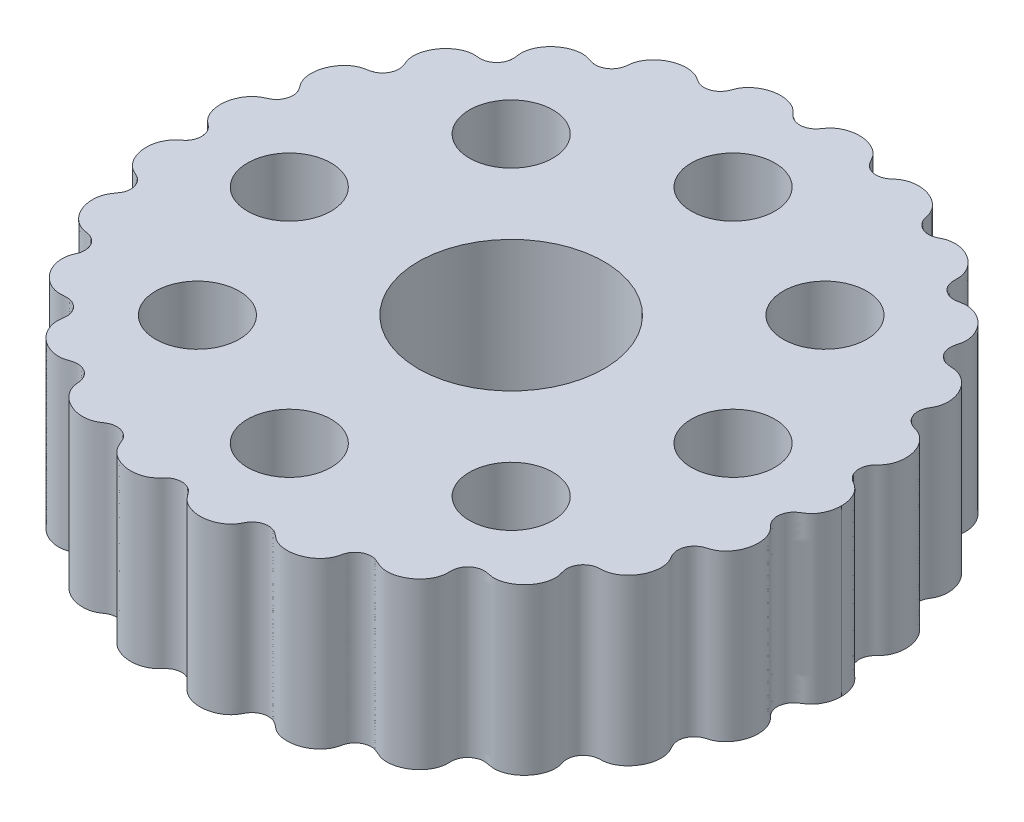
from build123d import *

# Parameters (mm, degrees)
SKETCH2_R           = 9
SKETCH2_R_2         = 4.05
BOSS_EXTRUDE1_DEPTH = 16


with BuildPart() as part:
    # Sketch2 → Boss-Extrude1 (new body)
    with BuildSketch(Plane(origin=(0, 0, 0), x_dir=(1, 0, 0), z_dir=(0, 1, 0))):
        with BuildLine():
            add(Edge.make_bspline(
                [(32, 0), (32, 0.104552359), (31.995829451, 0.244657698), (31.96343554, 0.497350887), (31.943165067, 0.61993286), (31.901921603, 0.80568742), (31.852763502, 0.982893961), (31.760589105, 1.245804685), (31.627237124, 1.52279712), (31.469006513, 1.77987865), (31.318033979, 1.972256306), (31.188685154, 2.110042639), (31.08776003, 2.205033558), (30.999896393, 2.277793707), (30.927586616, 2.332015187), (30.871350262, 2.371443406), (30.808959786, 2.412466941), (30.751215591, 2.448323808), (30.692536257, 2.483902195), (30.642070523, 2.514002995), (30.55901953, 2.565809095), (30.469377479, 2.623038148), (30.321527704, 2.737539295), (30.176012212, 2.871552443), (29.903186489, 3.199909992), (29.700236636, 3.880910214), (29.818309853, 4.4864096), (29.981846057, 4.79028647), (30.090970352, 4.944247476), (30.17460262, 5.045909438), (30.244053458, 5.122786372), (30.311532105, 5.192651081), (30.35745816, 5.238896611), (30.401172942, 5.283216119), (30.443609982, 5.32775139), (30.493548536, 5.383032964), (30.539132759, 5.4366663), (30.596386498, 5.508393759), (30.662356638, 5.599742771), (30.736452975, 5.717426066), (30.804511185, 5.841985834), (30.886870921, 6.016733349), (30.973207508, 6.250013511), (31.047548585, 6.547210121), (31.091258139, 6.856419861), (31.107870152, 7.278384281), (31.049891116, 7.811823414), (30.858103265, 8.42874362), (30.604284315, 8.89743226), (30.353358646, 9.229411908), (30.144291631, 9.452912412), (29.955708118, 9.614738773), (29.79910746, 9.727251873), (29.679319525, 9.802888314), (29.557565984, 9.869588689), (29.455588888, 9.917292552), (29.370396403, 9.95225453), (29.304219555, 9.977077554), (29.232725716, 10.001492535), (29.174448038, 10.019646819), (29.108818525, 10.039159146), (29.039840554, 10.059223915), (28.931074643, 10.095014686), (28.833939509, 10.127640531), (28.652968123, 10.2098928), (28.42260129, 10.336760516), (28.019143925, 10.711051717), (27.761965655, 11.354332939), (27.789507147, 11.891036105), (27.87221039, 12.163811806), (27.935251939, 12.315347057), (27.985501378, 12.417480742), (28.024991397, 12.491719407), (28.06947836, 12.570632793), (28.102908707, 12.628110139), (28.137872269, 12.688330119), (28.167209651, 12.740503157), (28.199361547, 12.801997668), (28.229499494, 12.864308614), (28.266797357, 12.948101554), (28.308366222, 13.054879476), (28.350623015, 13.187611316), (28.396712271, 13.370662906), (28.435043025, 13.611892848), (28.448908857, 13.915240837), (28.430019045, 14.223703272), (28.361500214, 14.638188146), (28.196911243, 15.147181142), (27.883300662, 15.71249513), (27.53860302, 16.121393259), (27.223639196, 16.398310017), (26.971817218, 16.577434962), (26.708067889, 16.725352804), (26.483376119, 16.819944918), (26.303628631, 16.877405045), (26.169148263, 16.911363393), (26.058524801, 16.931910053), (25.967118106, 16.944379376), (25.896640852, 16.951812934), (25.820780347, 16.957565886), (25.759838564, 16.960490442), (25.687870542, 16.963224576), (25.611963098, 16.965502659), (25.489490968, 16.975098019), (25.383984869, 16.981519114), (25.145326776, 17.031127475), (24.83545184, 17.124405377), (24.306622424, 17.505424554), (24.006772436, 18.090477523), (23.958888189, 18.540418781), (23.986174408, 18.852722806), (24.01934153, 18.987870495), (24.041791154, 19.084745192), (24.064644506, 19.167384365), (24.081952801, 19.228944541), (24.100111084, 19.293474135), (24.115170355, 19.350473226), (24.130897605, 19.418203947), (24.144392609, 19.485961231), (24.159450449, 19.576415233), (24.172868415, 19.690224451), (24.180449364, 19.829400723), (24.179433235, 19.97115919), (24.16652918, 20.163619715), (24.12851506, 20.410452195), (24.049229739, 20.706447103), (23.900019674, 21.095357267), (23.636415258, 21.559161529), (23.214511253, 22.048446484), (22.792528514, 22.37994239), (22.426260545, 22.588784498), (22.141240504, 22.714946241), (21.849177494, 22.809134729), (21.607677317, 22.858570104), (21.416097433, 22.880750301), (21.273531458, 22.888737815), (21.13391659, 22.887914443), (21.024423736, 22.880226916), (20.935791711, 22.86954177), (20.864722963, 22.85871337), (20.786771795, 22.844665842), (20.711729149, 22.829472252), (20.648015818, 22.81589924), (20.584655505, 22.802234304), (20.485953998, 22.782237116), (20.367126506, 22.765318385), (20.239852309, 22.751878016), (20.031705229, 22.752803226), (19.649405208, 22.788057784), (18.99695201, 23.155474328), (18.683045878, 23.649276859), (18.576999256, 24.003400852), (18.542947223, 24.264963729), (18.542038834, 24.379953401), (18.540471611, 24.480242727), (18.542125383, 24.560748637), (18.543546065, 24.622458485), (18.544952615, 24.687004459), (18.545224364, 24.745260227), (18.543444351, 24.814872528), (18.539495143, 24.883749829), (18.531356095, 24.975074493), (18.515760874, 25.088604194), (18.488125739, 25.225325383), (18.439348183, 25.408045878), (18.35551971, 25.637927338), (18.220248764, 25.91002869), (17.998328956, 26.25781591), (17.647679344, 26.657159235), (17.135653065, 27.049771615), (16.557822491, 27.336905777), (16.046936249, 27.475590363), (15.636646996, 27.521420752), (15.335050355, 27.522743408), (15.094105128, 27.496277469), (14.907486188, 27.458883387), (14.772655381, 27.42305117), (14.668854131, 27.388188028), (14.585603761, 27.355523076), (14.519125435, 27.327024127), (14.446456923, 27.293556372), (14.376454811, 27.259514284), (14.317280658, 27.230103106), (14.254656827, 27.198715646), (14.154486211, 27.151231002), (14.034088625, 27.102668267), (13.892770508, 27.054813025), (13.686947078, 27.006403392), (13.417853878, 26.989316109), (13.124928138, 27.015651051), (12.788162718, 27.123824563), (12.415040219, 27.347559755), (12.132565961, 27.669159911), (11.994348732, 27.93802665), (11.91672635, 28.145426445), (11.892224449, 28.240319141), (11.866457855, 28.336544686), (11.843448669, 28.435340061), (11.824275636, 28.518203577), (11.807258136, 28.585187035), (11.788032612, 28.652210348), (11.766942716, 28.717792178), (11.73613561, 28.804129705), (11.69251815, 28.910120225), (11.631400501, 29.035602491), (11.561487632, 29.159226768), (11.456493062, 29.321497294), (11.303240918, 29.518991484), (11.090015553, 29.739484209), (10.850490687, 29.940278513), (10.500724897, 30.177969535), (10.017333975, 30.411108368), (9.392606591, 30.574859819), (8.860920839, 30.607546875), (8.447263288, 30.570142354), (8.146290077, 30.510728768), (7.911901543, 30.436850188), (7.733785646, 30.363178187), (7.605241298, 30.300850441), (7.48371312, 30.232318108), (7.392503104, 30.172830587), (7.320512528, 30.120545554), (7.26305649, 30.076024441), (7.200067504, 30.024540041), (7.138660524, 29.972287993), (7.08672707, 29.927530674), (7.031720851, 29.879828085), (6.940907967, 29.805117669), (6.820127718, 29.718028271), (6.663332447, 29.62335176), (6.44551997, 29.52078195), (6.114639508, 29.443538741), (5.770234773, 29.433760049), (5.429192518, 29.506762993), (5.075008587, 29.663900411), (4.78655183, 29.901702256), (4.632643226, 30.093772504), (4.529362242, 30.248291257), (4.487511115, 30.324426184), (4.440149382, 30.409684376), (4.395658964, 30.495331793), (4.357661876, 30.568364646), (4.324725401, 30.628290694), (4.289268366, 30.688382983), (4.252432226, 30.746486343), (4.200932968, 30.822314163), (4.132071606, 30.913981866), (4.041325111, 31.020183723), (3.909657972, 31.156411303), (3.724406661, 31.316891638), (3.473806746, 31.489230646), (3.2015031, 31.636571455), (2.813155882, 31.797834138), (2.293861384, 31.927612853), (1.648335842, 31.960761658), (1.119117792, 31.884683923), (0.718177772, 31.764062431), (0.433164002, 31.645086009), (0.169041283, 31.499796056), (-0.029248737, 31.359336599), (-0.172745424, 31.237103685), (-0.272264794, 31.140999533), (-0.347260486, 31.058664566), (-0.406199461, 30.987319842), (-0.450589958, 30.930201605), (-0.49742239, 30.866266442), (-0.535053615, 30.812405615), (-0.583002142, 30.742117581), (-0.641591047, 30.659879604), (-0.705089651, 30.574443021), (-0.812063163, 30.451455815), (-0.954143269, 30.308788214), (-1.291204427, 30.064797539), (-1.921437901, 29.883088278), (-2.604055935, 30.034725212), (-2.864349982, 30.204247323), (-3.0253248, 30.323205516), (-3.141204595, 30.431071039), (-3.22582741, 30.519267586), (-3.2768809, 30.576403618), (-3.323016011, 30.627497751), (-3.377885056, 30.687681557), (-3.434185365, 30.747028743), (-3.485712587, 30.798635942), (-3.53450512, 30.844550413), (-3.599624604, 30.90188148), (-3.688258957, 30.972409145), (-3.80415471, 31.053225099), (-3.926984858, 31.128291644), (-4.097813376, 31.219342884), (-4.326107901, 31.316899207), (-4.621365038, 31.406633149), (-5.030249239, 31.485750615), (-5.563956761, 31.507476112), (-6.202335393, 31.40843171), (-6.706362739, 31.226125908), (-7.077531334, 31.025674392), (-7.334835806, 30.850883417), (-7.568068893, 30.653566443), (-7.738498441, 30.473764173), (-7.857480134, 30.32405925), (-7.938297602, 30.208687048), (-8.010521424, 30.090598792), (-8.063927448, 29.989382375), (-8.10286703, 29.906256495), (-8.130426686, 29.842178682), (-8.155649541, 29.778238292), (-8.184617038, 29.699706254), (-8.218914025, 29.606963542), (-8.255828699, 29.515425256), (-8.289967177, 29.43012565), (-8.381806635, 29.249424646), (-8.531447492, 29.021223129), (-8.870410959, 28.681835574), (-9.41257982, 28.46273851), (-9.840772665, 28.449255098), (-10.143099076, 28.492896227), (-10.373654508, 28.573999903), (-10.515256333, 28.642384153), (-10.620252232, 28.699820117), (-10.719259893, 28.761104535), (-10.791301322, 28.809244151), (-10.852197537, 28.850276522), (-10.907573969, 28.886627288), (-10.97497559, 28.92870045), (-11.037242518, 28.965166592), (-11.097926546, 28.998304811), (-11.177851626, 29.038667441), (-11.281171616, 29.084660653), (-11.412716102, 29.133525963), (-11.595366869, 29.188955611), (-11.835372407, 29.239348854), (-12.137832436, 29.268250792), (-12.551808205, 29.263796112), (-13.076032332, 29.177491747), (-13.680503352, 28.950752021), (-14.229519783, 28.61285716), (-14.617856054, 28.252172594), (-14.872351575, 27.929880025), (-15.033084646, 27.673953316), (-15.137690115, 27.455934483), (-15.203281151, 27.280194989), (-15.243520908, 27.147799823), (-15.269793182, 27.03643075), (-15.286630315, 26.946063131), (-15.297209043, 26.877215464), (-15.305673656, 26.808190254), (-15.314376755, 26.72222192), (-15.325242045, 26.618467786), (-15.338994693, 26.519295492), (-15.353024674, 26.414130757), (-15.410494368, 26.180616223), (-15.536145389, 25.869756619), (-15.863491889, 25.424068136), (-16.525348218, 25.090742194), (-16.980998188, 25.077695739), (-17.212740069, 25.106674662), (-17.34006089, 25.135357302), (-17.447145007, 25.163817494), (-17.550652638, 25.197117676), (-17.626654011, 25.223938844), (-17.692177692, 25.247209589), (-17.755124242, 25.268615591), (-17.830061256, 25.29217431), (-17.899226895, 25.31177389), (-17.966108964, 25.32856231), (-18.053598475, 25.347550377), (-18.165327316, 25.366145809), (-18.305033543, 25.380426624), (-18.448176274, 25.386284952), (-18.642549625, 25.382793011), (-18.890732711, 25.357084815), (-19.191613394, 25.292393543), (-19.489149312, 25.195192808), (-19.875954059, 25.024110527), (-20.329932993, 24.737181789), (-20.799471289, 24.29392149), (-21.108368554, 23.860061031), (-21.295099053, 23.489955621), (-21.403091687, 23.204477475), (-21.464656385, 22.964841453), (-21.495837947, 22.776554232), (-21.510363448, 22.636679983), (-21.516056587, 22.498493639), (-21.513519932, 22.384103893), (-21.507113733, 22.292281501), (-21.500076557, 22.223055505), (-21.492395517, 22.164976744), (-21.482689727, 22.09991183), (-21.473390394, 22.037779337), (-21.461358093, 21.955536546), (-21.45079303, 21.856230109), (-21.436007456, 21.730345039), (-21.44205944, 21.444272268), (-21.521034236, 21.040950345), (-21.835153413, 20.49661962), (-22.417476349, 20.124581177), (-22.772343388, 20.053507021), (-22.975784012, 20.033892713), (-23.076062758, 20.033750884), (-23.175622145, 20.035207603), (-23.274668811, 20.041550562), (-23.354639545, 20.048446028), (-23.427575103, 20.055107295), (-23.488779034, 20.059830836), (-23.564907303, 20.063752745), (-23.635883426, 20.065290751), (-23.705157528, 20.064694891), (-23.795683678, 20.061020357), (-23.909017744, 20.050931788), (-24.047586563, 20.029745237), (-24.233838439, 19.989507141), (-24.468929755, 19.916670243), (-24.747671685, 19.794984602), (-25.017462083, 19.641344197), (-25.35996528, 19.396955614), (-25.745133482, 19.024789847), (-26.11493807, 18.494636808), (-26.330247972, 18.005707608), (-26.439917212, 17.601887695), (-26.489407587, 17.298236552), (-26.505617724, 16.996702841), (-26.491149336, 16.755804803), (-26.463096435, 16.57065071), (-26.433913642, 16.435505779), (-26.402736363, 16.325433757), (-26.3734265, 16.238020882), (-26.349277843, 16.172881247), (-26.326975315, 16.117860009), (-26.30033194, 16.054928129), (-26.275002652, 15.994938909), (-26.241028828, 15.913281138), (-26.207158422, 15.820207457), (-26.152654231, 15.67728857), (-26.086348597, 15.338858265), (-26.098548624, 14.843785162), (-26.379720754, 14.225231955), (-26.847679338, 13.843923259), (-27.115940341, 13.732146229), (-27.325372307, 13.663719981), (-27.426924416, 13.643963731), (-27.543383279, 13.620596313), (-27.616272475, 13.609099769), (-27.68554536, 13.597674077), (-27.745620119, 13.587053434), (-27.81987775, 13.57181754), (-27.911763238, 13.550108263), (-28.020863545, 13.518940084), (-28.149471339, 13.473051038), (-28.278419884, 13.417696613), (-28.406164633, 13.353362493), (-28.574643289, 13.255686438), (-28.779766518, 13.112220907), (-29.011276162, 12.909728094), (-29.295572145, 12.603520029), (-29.596329541, 12.162331767), (-29.850363761, 11.56796874), (-29.962331369, 11.044148093), (-29.988572145, 10.623487155), (-29.97631191, 10.313172346), (-29.932145484, 10.011400015), (-29.869651348, 9.77236049), (-29.805530854, 9.592989833), (-29.750329088, 9.463905132), (-29.688168249, 9.340486456), (-29.630358534, 9.241780662), (-29.579937045, 9.164387885), (-29.540308231, 9.107515443), (-29.504305338, 9.059069929), (-29.461192579, 9.002591865), (-29.420076683, 8.948787957), (-29.364453679, 8.873536745), (-29.316452262, 8.805406688), (-29.24793868, 8.700121477), (-29.161098201, 8.543720364), (-29.03929822, 8.251055454), (-28.970092342, 7.678170429), (-29.198157642, 7.02013707), (-29.536746191, 6.659473092), (-29.732232091, 6.521093053), (-29.886010146, 6.429361508), (-29.977943506, 6.384368226), (-30.077647775, 6.337664893), (-30.141874637, 6.309769041), (-30.202997727, 6.282869038), (-30.258578677, 6.257447741), (-30.326162142, 6.224316753), (-30.409443108, 6.180346623), (-30.507121682, 6.122831868), (-30.62020937, 6.046027371), (-30.731216679, 5.95999784), (-30.87468741, 5.834108144), (-31.045038735, 5.655999012), (-31.22980472, 5.414051507), (-31.445084778, 5.060038692), (-31.649493929, 4.568971214), (-31.777074644, 3.936038571), (-31.780240814, 3.398829292), (-31.72070374, 2.979746612), (-31.645712821, 2.675365403), (-31.541463867, 2.38551111), (-31.409855068, 2.115408768), (-31.279845564, 1.911399076), (-31.165208893, 1.762962948), (-31.075105966, 1.660287079), (-30.995312996, 1.580412134), (-30.925785281, 1.517014824), (-30.868848792, 1.46814433), (-30.82073627, 1.429010807), (-30.770479245, 1.38943718), (-30.718233641, 1.348667372), (-30.640449805, 1.28548124), (-30.564173169, 1.220568786), (-30.460292855, 1.120060377), (-30.337831544, 0.987535241), (-30.198120503, 0.773343684), (-30.105340046, 0.578043453), (-30.04555615, 0.391295977), (-30.009102278, 0.196773807), (-30, 0.062633005), (-30, 0)],
                knots=[0.072083776, 0.072083776, 0.072083776, 0.072083776, 0.075437288, 0.077114043, 0.078790799, 0.080467554, 0.08214431, 0.085497821, 0.088851332, 0.092204844, 0.095558355, 0.097235111, 0.098911866, 0.100588622, 0.101427, 0.102265377, 0.103103755, 0.103942133, 0.104361322, 0.104780511, 0.1051997, 0.105618889, 0.105828483, 0.106038077, 0.106247672, 0.106457266, 0.106666861, 0.106876455, 0.10708605, 0.107295644, 0.107714833, 0.108134022, 0.108553211, 0.1089724, 0.109810778, 0.110649155, 0.111487533, 0.112325911, 0.114002667, 0.115679422, 0.117356178, 0.119032933, 0.122386445, 0.125739956, 0.129093467, 0.132446978, 0.139154001, 0.145861023, 0.152568046, 0.155921557, 0.159275068, 0.162628579, 0.164305335, 0.165982091, 0.167658846, 0.169335602, 0.17017398, 0.171012357, 0.171850735, 0.172689113, 0.173108302, 0.173527491, 0.17394668, 0.174365869, 0.174575463, 0.174785057, 0.174994652, 0.175204246, 0.175413841, 0.175623435, 0.17583303, 0.176042624, 0.176461813, 0.176881002, 0.177300191, 0.17771938, 0.178557758, 0.179396135, 0.180234513, 0.181072891, 0.182749647, 0.184426402, 0.186103158, 0.189456669, 0.19281018, 0.196163692, 0.199517203, 0.206224225, 0.212931248, 0.21963827, 0.222991781, 0.226345292, 0.229698804, 0.233052315, 0.234729071, 0.236405826, 0.238082582, 0.23892096, 0.239759337, 0.240597715, 0.241436093, 0.241855282, 0.242274471, 0.24269366, 0.243112849, 0.243322443, 0.243532037, 0.243741632, 0.243951226, 0.244160821, 0.244370415, 0.244789604, 0.245208793, 0.245627982, 0.246047171, 0.24646636, 0.247304738, 0.248143115, 0.248981493, 0.249819871, 0.251496627, 0.253173382, 0.254850138, 0.256526893, 0.259880405, 0.263233916, 0.266587427, 0.27329445, 0.280001472, 0.286708494, 0.290062006, 0.293415517, 0.296769028, 0.300122539, 0.301799295, 0.303476051, 0.305152806, 0.306829562, 0.30766794, 0.308506317, 0.309344695, 0.310183073, 0.310602262, 0.311021451, 0.31144064, 0.311650234, 0.311859829, 0.312069423, 0.312279017, 0.312488612, 0.312698206, 0.312907801, 0.313117395, 0.313536584, 0.313955773, 0.314374962, 0.314794151, 0.31521334, 0.316051718, 0.316890095, 0.317728473, 0.318566851, 0.320243607, 0.321920362, 0.323597118, 0.326950629, 0.33030414, 0.333657652, 0.340364674, 0.347071696, 0.353778719, 0.360485741, 0.363839252, 0.367192764, 0.370546275, 0.372223031, 0.373899786, 0.375576542, 0.37641492, 0.377253297, 0.378091675, 0.378930053, 0.379349242, 0.379768431, 0.38018762, 0.380397214, 0.380606809, 0.380816403, 0.3809212, 0.381025997, 0.381130795, 0.381235592, 0.381445186, 0.381654781, 0.381864375, 0.382283564, 0.382702753, 0.383121942, 0.38396032, 0.384798698, 0.385637075, 0.386475453, 0.387313831, 0.388990587, 0.390667342, 0.392344098, 0.394020853, 0.397374365, 0.400727876, 0.404081387, 0.407434898, 0.414141921, 0.420848943, 0.427555966, 0.430909477, 0.434262988, 0.437616499, 0.439293255, 0.440970011, 0.442646766, 0.444323522, 0.4451619, 0.446000277, 0.446838655, 0.447677033, 0.448096222, 0.448515411, 0.4489346, 0.449144194, 0.449353789, 0.449563383, 0.44966818, 0.449772977, 0.449877775, 0.449982572, 0.450192166, 0.450401761, 0.450611355, 0.451030544, 0.451449733, 0.451868922, 0.4527073, 0.453545678, 0.454384055, 0.455222433, 0.456060811, 0.457737567, 0.459414322, 0.461091078, 0.464444589, 0.4677981, 0.471151612, 0.474505123, 0.481212145, 0.487919168, 0.49462619, 0.497979701, 0.501333212, 0.504686724, 0.508040235, 0.509716991, 0.511393746, 0.513070502, 0.51390888, 0.514747257, 0.515585635, 0.516424013, 0.516843202, 0.517262391, 0.51768158, 0.517891174, 0.518100769, 0.518310363, 0.518519957, 0.518729552, 0.518939146, 0.519148741, 0.519358335, 0.519777524, 0.520196713, 0.520615902, 0.52145428, 0.522292658, 0.523131035, 0.523969413, 0.524807791, 0.526484547, 0.528161302, 0.529838058, 0.531514813, 0.534868325, 0.538221836, 0.541575347, 0.54828237, 0.554989392, 0.561696414, 0.565049926, 0.568403437, 0.571756948, 0.575110459, 0.576787215, 0.578463971, 0.580140726, 0.581817482, 0.58265586, 0.583494237, 0.584332615, 0.585170993, 0.585590182, 0.586009371, 0.58642856, 0.586638154, 0.586847749, 0.587057343, 0.587266937, 0.587371735, 0.587476532, 0.587686126, 0.587895721, 0.588105315, 0.588524504, 0.588943693, 0.589362882, 0.59020126, 0.591039638, 0.591878015, 0.592716393, 0.593554771, 0.595231527, 0.596908282, 0.598585038, 0.601938549, 0.60529206, 0.608645572, 0.615352594, 0.622059616, 0.628766639, 0.635473661, 0.638827172, 0.642180684, 0.645534195, 0.647210951, 0.648887706, 0.650564462, 0.65140284, 0.652241217, 0.653079595, 0.653917973, 0.654337162, 0.654756351, 0.65517554, 0.655385134, 0.655594729, 0.655804323, 0.656013917, 0.656223512, 0.656433106, 0.656642701, 0.656852295, 0.657271484, 0.657690673, 0.658109862, 0.65894824, 0.659786618, 0.660624995, 0.661463373, 0.662301751, 0.663978507, 0.665655262, 0.667332018, 0.669008773, 0.672362285, 0.675715796, 0.679069307, 0.682422818, 0.689129841, 0.695836863, 0.702543886, 0.705897397, 0.709250908, 0.712604419, 0.714281175, 0.715957931, 0.717634686, 0.719311442, 0.72014982, 0.720988197, 0.721826575, 0.722245764, 0.722664953, 0.723084142, 0.723503331, 0.72392252, 0.724132114, 0.724341709, 0.724551303, 0.724760897, 0.724970492, 0.725180086, 0.725389681, 0.725599275, 0.726018464, 0.726437653, 0.726856842, 0.72769522, 0.728533598, 0.729371975, 0.730210353, 0.731048731, 0.732725487, 0.734402242, 0.736078998, 0.739432509, 0.74278602, 0.746139532, 0.749493043, 0.756200065, 0.762907088, 0.76961411, 0.772967621, 0.776321132, 0.779674644, 0.783028155, 0.784704911, 0.786381666, 0.788058422, 0.7888968, 0.789735177, 0.790573555, 0.790992744, 0.791411933, 0.791831122, 0.792250311, 0.7926695, 0.792879094, 0.793088689, 0.793298283, 0.793507877, 0.793717472, 0.793927066, 0.794346255, 0.794765444, 0.795184633, 0.795603822, 0.7964422, 0.797280578, 0.798118955, 0.799795711, 0.801472467, 0.803149222, 0.804825978, 0.806502733, 0.809856245, 0.813209756, 0.816563267, 0.82327029, 0.829977312, 0.836684334, 0.840037846, 0.843391357, 0.846744868, 0.850098379, 0.851775135, 0.853451891, 0.855128646, 0.856805402, 0.85764378, 0.858482157, 0.859320535, 0.859739724, 0.860158913, 0.860578102, 0.860997291, 0.861206885, 0.86141648, 0.861626074, 0.861835669, 0.862045263, 0.862254857, 0.862464452, 0.862674046, 0.863093235, 0.863512424, 0.863931613, 0.864350802, 0.86518918, 0.866027558, 0.866865935, 0.868542691, 0.870219447, 0.871896202, 0.873572958, 0.876926469, 0.88027998, 0.883633492, 0.890340514, 0.897047536, 0.903754559, 0.90710807, 0.910461581, 0.913815092, 0.917168604, 0.920522115, 0.922198871, 0.923875626, 0.925552382, 0.92639076, 0.927229137, 0.928067515, 0.928486704, 0.928905893, 0.929325082, 0.929744271, 0.929953865, 0.93016346, 0.930268257, 0.930373054, 0.930477851, 0.93053025, 0.930582649, 0.930582649, 0.930582649, 0.930582649], degree=3))
            add(Edge.make_bspline(
                [(-30, 0), (-30, -0.062633005), (-30.009102278, -0.196773807), (-30.04555615, -0.391295977), (-30.105340046, -0.578043453), (-30.198120503, -0.773343684), (-30.337831544, -0.987535241), (-30.460292855, -1.120060377), (-30.564173169, -1.220568786), (-30.640449805, -1.28548124), (-30.718233641, -1.348667372), (-30.770479245, -1.389437179), (-30.82073627, -1.429010807), (-30.868848792, -1.46814433), (-30.925785281, -1.517014824), (-30.995312996, -1.580412134), (-31.075105966, -1.660287079), (-31.165208893, -1.762962948), (-31.279845564, -1.911399076), (-31.409855068, -2.115408768), (-31.541463867, -2.38551111), (-31.645712821, -2.675365403), (-31.72070374, -2.979746612), (-31.780240814, -3.398829292), (-31.777074644, -3.936038571), (-31.649493929, -4.568971214), (-31.445084778, -5.060038692), (-31.229804721, -5.414051507), (-31.045038735, -5.655999012), (-30.87468741, -5.834108144), (-30.731216679, -5.95999784), (-30.62020937, -6.046027371), (-30.507121683, -6.122831868), (-30.409443108, -6.180346623), (-30.326162142, -6.224316753), (-30.258578677, -6.257447741), (-30.202997727, -6.282869038), (-30.141874637, -6.309769041), (-30.077647776, -6.337664893), (-29.977943507, -6.384368226), (-29.886010147, -6.429361508), (-29.732232092, -6.521093052), (-29.536746193, -6.659473091), (-29.198157645, -7.020137064), (-28.970092342, -7.678170423), (-29.039298219, -8.25105545), (-29.1610982, -8.543720362), (-29.247938679, -8.700121476), (-29.316452262, -8.805406688), (-29.364453678, -8.873536744), (-29.420076683, -8.948787957), (-29.461192579, -9.002591864), (-29.504305338, -9.059069929), (-29.540308231, -9.107515443), (-29.579937045, -9.164387884), (-29.630358534, -9.241780662), (-29.688168249, -9.340486456), (-29.750329088, -9.463905132), (-29.805530854, -9.592989833), (-29.869651348, -9.77236049), (-29.932145484, -10.011400015), (-29.97631191, -10.313172346), (-29.988572145, -10.623487154), (-29.962331369, -11.044148092), (-29.850363761, -11.56796874), (-29.596329541, -12.162331767), (-29.295572146, -12.603520029), (-29.011276162, -12.909728094), (-28.779766518, -13.112220907), (-28.574643289, -13.255686437), (-28.406164633, -13.353362492), (-28.278419884, -13.417696613), (-28.14947134, -13.473051038), (-28.020863546, -13.518940084), (-27.911763238, -13.550108263), (-27.81987775, -13.57181754), (-27.745620119, -13.587053434), (-27.685545361, -13.597674077), (-27.616272476, -13.609099769), (-27.54338328, -13.620596313), (-27.426924417, -13.64396373), (-27.325372308, -13.66371998), (-27.115940345, -13.732146228), (-26.847679345, -13.843923256), (-26.379720762, -14.225231945), (-26.098548626, -14.843785151), (-26.086348596, -15.338858259), (-26.152654231, -15.677288567), (-26.207158422, -15.820207456), (-26.241028828, -15.913281137), (-26.275002652, -15.994938908), (-26.30033194, -16.054928129), (-26.326975314, -16.117860009), (-26.349277843, -16.172881247), (-26.3734265, -16.238020882), (-26.402736363, -16.325433757), (-26.433913642, -16.435505779), (-26.463096435, -16.57065071), (-26.491149336, -16.755804802), (-26.505617724, -16.996702841), (-26.489407587, -17.298236551), (-26.439917213, -17.601887695), (-26.330247972, -18.005707608), (-26.11493807, -18.494636807), (-25.745133482, -19.024789847), (-25.359965281, -19.396955614), (-25.017462084, -19.641344197), (-24.747671686, -19.794984602), (-24.468929755, -19.916670243), (-24.233838439, -19.989507141), (-24.047586564, -20.029745237), (-23.909017744, -20.050931788), (-23.795683679, -20.061020357), (-23.705157528, -20.064694891), (-23.635883427, -20.065290751), (-23.564907304, -20.063752745), (-23.488779034, -20.059830836), (-23.427575103, -20.055107295), (-23.354639546, -20.048446028), (-23.274668812, -20.041550562), (-23.175622147, -20.035207603), (-23.07606276, -20.033750884), (-22.975784016, -20.033892713), (-22.772343395, -20.05350702), (-22.417476363, -20.124581172), (-21.835153426, -20.496619605), (-21.52103424, -21.040950331), (-21.442059441, -21.44427226), (-21.436007455, -21.730345036), (-21.45079303, -21.856230108), (-21.461358093, -21.955536545), (-21.473390394, -22.037779336), (-21.482689727, -22.099911829), (-21.492395517, -22.164976744), (-21.500076557, -22.223055505), (-21.507113733, -22.2922815), (-21.513519932, -22.384103893), (-21.516056587, -22.498493639), (-21.510363448, -22.636679982), (-21.495837947, -22.776554231), (-21.464656385, -22.964841453), (-21.403091688, -23.204477475), (-21.295099053, -23.48995562), (-21.108368555, -23.86006103), (-20.799471289, -24.293921489), (-20.329932994, -24.737181789), (-19.875954059, -25.024110527), (-19.489149312, -25.195192808), (-19.191613395, -25.292393543), (-18.890732712, -25.357084815), (-18.642549625, -25.382793011), (-18.448176275, -25.386284952), (-18.305033544, -25.380426624), (-18.165327316, -25.366145809), (-18.053598476, -25.347550377), (-17.966108964, -25.32856231), (-17.899226896, -25.31177389), (-17.830061256, -25.29217431), (-17.755124243, -25.268615591), (-17.692177693, -25.247209589), (-17.626654012, -25.223938845), (-17.550652639, -25.197117677), (-17.44714501, -25.163817495), (-17.340060893, -25.135357303), (-17.212740075, -25.106674663), (-16.980998198, -25.07769574), (-16.525348242, -25.090742189), (-15.863491907, -25.42406812), (-15.536145396, -25.869756605), (-15.41049437, -26.180616215), (-15.353024674, -26.414130754), (-15.338994694, -26.51929549), (-15.325242046, -26.618467784), (-15.314376755, -26.722221918), (-15.305673657, -26.808190254), (-15.297209043, -26.877215463), (-15.286630315, -26.946063131), (-15.269793182, -27.03643075), (-15.243520908, -27.147799823), (-15.203281151, -27.280194989), (-15.137690115, -27.455934482), (-15.033084646, -27.673953315), (-14.872351576, -27.929880025), (-14.617856054, -28.252172594), (-14.229519783, -28.61285716), (-13.680503352, -28.950752021), (-13.076032333, -29.177491746), (-12.551808206, -29.263796111), (-12.137832437, -29.268250792), (-11.835372408, -29.239348854), (-11.59536687, -29.188955611), (-11.412716103, -29.133525963), (-11.281171617, -29.084660654), (-11.177851627, -29.038667441), (-11.097926546, -28.998304812), (-11.037242519, -28.965166592), (-10.97497559, -28.928700451), (-10.90757397, -28.886627288), (-10.852197537, -28.850276523), (-10.791301324, -28.809244152), (-10.719259895, -28.761104536), (-10.620252235, -28.699820119), (-10.515256337, -28.642384155), (-10.373654517, -28.573999907), (-10.143099091, -28.492896232), (-9.840772689, -28.449255099), (-9.412579853, -28.462738503), (-8.87041098, -28.681835558), (-8.531447503, -29.021223115), (-8.38180664, -29.249424639), (-8.289967178, -29.430125647), (-8.2558287, -29.515425254), (-8.218914025, -29.606963541), (-8.184617039, -29.699706253), (-8.155649542, -29.778238291), (-8.130426686, -29.842178681), (-8.10286703, -29.906256494), (-8.063927449, -29.989382374), (-8.010521425, -30.090598792), (-7.938297603, -30.208687047), (-7.857480134, -30.32405925), (-7.738498441, -30.473764173), (-7.568068894, -30.653566442), (-7.334835806, -30.850883416), (-7.077531335, -31.025674391), (-6.70636274, -31.226125907), (-6.202335394, -31.40843171), (-5.563956762, -31.507476112), (-5.03024924, -31.485750615), (-4.621365039, -31.406633149), (-4.326107902, -31.316899208), (-4.097813377, -31.219342884), (-3.926984859, -31.128291645), (-3.804154711, -31.053225099), (-3.688258957, -30.972409146), (-3.599624605, -30.90188148), (-3.53450512, -30.844550413), (-3.485712588, -30.798635943), (-3.434185366, -30.747028743), (-3.377885057, -30.687681558), (-3.323016012, -30.627497752), (-3.276880901, -30.576403619), (-3.225827413, -30.519267589), (-3.141204598, -30.431071042), (-3.025324806, -30.323205522), (-2.864349993, -30.20424733), (-2.604055958, -30.034725224), (-1.921437944, -29.883088277), (-1.291204451, -30.064797524), (-0.95414328, -30.308788203), (-0.812063168, -30.451455809), (-0.705089654, -30.574443018), (-0.641591049, -30.659879601), (-0.583002143, -30.742117579), (-0.535053615, -30.812405614), (-0.497422391, -30.866266441), (-0.450589958, -30.930201604), (-0.406199461, -30.987319841), (-0.347260487, -31.058664565), (-0.272264794, -31.140999532), (-0.172745425, -31.237103684), (-0.029248738, -31.359336598), (0.169041283, -31.499796055), (0.433164001, -31.645086009), (0.718177771, -31.764062431), (1.119117791, -31.884683923), (1.648335841, -31.960761658), (2.293861383, -31.927612853), (2.81315588, -31.797834139), (3.201503099, -31.636571455), (3.473806745, -31.489230647), (3.72440666, -31.316891639), (3.909657971, -31.156411304), (4.04132511, -31.020183724), (4.132071605, -30.913981867), (4.200932968, -30.822314164), (4.252432225, -30.746486344), (4.289268365, -30.688382984), (4.324725401, -30.628290695), (4.357661875, -30.568364647), (4.395658963, -30.495331795), (4.440149381, -30.409684379), (4.487511113, -30.324426186), (4.52936224, -30.248291261), (4.632643219, -30.093772514), (4.786551815, -29.901702271), (5.075008561, -29.663900428), (5.42919248, -29.506763006), (5.770234728, -29.433760053), (6.114639469, -29.443538735), (6.44551995, -29.520781942), (6.663332434, -29.623351753), (6.820127711, -29.718028266), (6.940907963, -29.805117666), (7.031720848, -29.879828083), (7.086727069, -29.927530673), (7.138660523, -29.972287992), (7.200067503, -30.02454004), (7.263056489, -30.07602444), (7.320512527, -30.120545554), (7.392503103, -30.172830587), (7.483713119, -30.232318107), (7.605241297, -30.300850441), (7.733785645, -30.363178186), (7.911901542, -30.436850188), (8.146290075, -30.510728768), (8.447263286, -30.570142354), (8.860920837, -30.607546876), (9.39260659, -30.57485982), (10.017333973, -30.411108369), (10.500724896, -30.177969535), (10.850490686, -29.940278514), (11.090015552, -29.73948421), (11.303240917, -29.518991485), (11.456493061, -29.321497295), (11.561487632, -29.159226769), (11.631400501, -29.035602492), (11.69251815, -28.910120226), (11.73613561, -28.804129706), (11.766942716, -28.71779218), (11.788032611, -28.652210349), (11.807258136, -28.585187036), (11.824275635, -28.518203579), (11.843448669, -28.435340063), (11.866457854, -28.336544689), (11.892224448, -28.240319145), (11.916726348, -28.145426452), (11.994348726, -27.938026664), (12.132565945, -27.669159936), (12.415040189, -27.347559782), (12.788162672, -27.123824584), (13.12492809, -27.015651061), (13.417853843, -26.989316109), (13.686947056, -27.006403388), (13.892770495, -27.054813021), (14.034088618, -27.102668264), (14.154486205, -27.151231), (14.254656824, -27.198715645), (14.317280656, -27.230103105), (14.376454809, -27.259514283), (14.446456922, -27.293556371), (14.519125433, -27.327024127), (14.58560376, -27.355523075), (14.66885413, -27.388188028), (14.77265538, -27.423051169), (14.907486186, -27.458883387), (15.094105126, -27.496277469), (15.335050354, -27.522743408), (15.636646994, -27.521420752), (16.046936248, -27.475590364), (16.55782249, -27.336905778), (17.135653064, -27.049771616), (17.647679343, -26.657159236), (17.998328955, -26.257815912), (18.220248764, -25.910028692), (18.355519709, -25.637927339), (18.439348183, -25.40804588), (18.488125739, -25.225325385), (18.515760874, -25.088604196), (18.531356095, -24.975074494), (18.539495142, -24.883749831), (18.54344435, -24.814872529), (18.545224364, -24.745260229), (18.544952615, -24.687004461), (18.543546065, -24.622458487), (18.542125383, -24.560748639), (18.540471611, -24.480242731), (18.542038834, -24.379953404), (18.542947222, -24.264963738), (18.576999252, -24.003400873), (18.683045863, -23.649276896), (18.996951968, -23.155474369), (19.649405159, -22.788057796), (20.03170521, -22.752803226), (20.239852295, -22.751878015), (20.367126498, -22.765318384), (20.485953992, -22.782237115), (20.584655501, -22.802234304), (20.648015816, -22.815899239), (20.711729147, -22.829472251), (20.786771793, -22.844665842), (20.864722962, -22.85871337), (20.93579171, -22.86954177), (21.024423735, -22.880226916), (21.133916589, -22.887914443), (21.273531456, -22.888737815), (21.416097432, -22.880750301), (21.607677316, -22.858570104), (21.849177493, -22.809134729), (22.141240502, -22.714946242), (22.426260543, -22.588784499), (22.792528513, -22.379942391), (23.214511252, -22.048446485), (23.636415257, -21.55916153), (23.900019673, -21.095357268), (24.049229739, -20.706447104), (24.128515059, -20.410452196), (24.16652918, -20.163619717), (24.179433235, -19.971159192), (24.180449364, -19.829400725), (24.172868416, -19.690224452), (24.159450449, -19.576415235), (24.144392609, -19.485961232), (24.130897605, -19.418203949), (24.115170355, -19.350473228), (24.100111085, -19.293474137), (24.081952801, -19.228944544), (24.064644507, -19.167384368), (24.041791155, -19.084745196), (24.01934153, -18.987870499), (23.98617441, -18.852722817), (23.95888819, -18.540418809), (24.006772424, -18.090477574), (24.30662238, -17.505424604), (24.835451801, -17.124405393), (25.145326755, -17.03112748), (25.383984861, -16.981519114), (25.489490962, -16.97509802), (25.611963094, -16.965502659), (25.687870539, -16.963224576), (25.759838562, -16.960490442), (25.820780345, -16.957565886), (25.896640851, -16.951812934), (25.967118104, -16.944379376), (26.0585248, -16.931910053), (26.169148262, -16.911363393), (26.30362863, -16.877405046), (26.483376117, -16.819944918), (26.708067887, -16.725352805), (26.971817217, -16.577434963), (27.223639194, -16.398310018), (27.538603019, -16.12139326), (27.883300661, -15.712495132), (28.196911242, -15.147181144), (28.361500214, -14.638188148), (28.430019044, -14.223703274), (28.448908857, -13.915240839), (28.435043025, -13.61189285), (28.396712271, -13.370662908), (28.350623016, -13.187611318), (28.308366223, -13.054879477), (28.266797358, -12.948101555), (28.229499494, -12.864308615), (28.199361548, -12.801997669), (28.167209651, -12.740503159), (28.13787227, -12.688330121), (28.102908709, -12.628110141), (28.069478361, -12.570632796), (28.0249914, -12.491719412), (27.98550138, -12.417480746), (27.935251944, -12.315347067), (27.872210397, -12.163811825), (27.789507155, -11.891036143), (27.761965648, -11.354333002), (28.019143884, -10.711051774), (28.42260126, -10.336760535), (28.652968106, -10.209892809), (28.833939503, -10.127640533), (28.931074637, -10.095014688), (29.03984055, -10.059223916), (29.108818522, -10.039159147), (29.174448036, -10.019646819), (29.232725715, -10.001492536), (29.304219553, -9.977077555), (29.370396402, -9.952254531), (29.455588886, -9.917292552), (29.557565983, -9.86958869), (29.679319523, -9.802888315), (29.799107458, -9.727251874), (29.955708116, -9.614738775), (30.144291629, -9.452912414), (30.353358645, -9.22941191), (30.604284314, -8.897432262), (30.858103264, -8.428743622), (31.049891115, -7.811823416), (31.107870152, -7.278384283), (31.091258139, -6.856419863), (31.047548586, -6.547210124), (30.973207508, -6.250013513), (30.886870922, -6.016733351), (30.804511185, -5.841985836), (30.736452976, -5.717426068), (30.662356639, -5.599742773), (30.596386499, -5.508393761), (30.53913276, -5.436666301), (30.493548537, -5.383032966), (30.443609983, -5.327751391), (30.401172944, -5.28321612), (30.357458163, -5.238896613), (30.311532108, -5.192651084), (30.244053463, -5.122786377), (30.174602624, -5.045909442), (30.090970361, -4.944247487), (29.981846071, -4.790286492), (29.818309873, -4.48640965), (29.700236634, -3.880910289), (29.903186453, -3.199910053), (30.176012193, -2.87155246), (30.32152769, -2.737539307), (30.469377472, -2.623038152), (30.559019524, -2.565809099), (30.64207052, -2.514002997), (30.692536254, -2.483902197), (30.751215589, -2.448323809), (30.808959784, -2.412466943), (30.871350261, -2.371443407), (30.927586615, -2.332015189), (30.999896392, -2.277793709), (31.087760028, -2.205033559), (31.188685153, -2.11004264), (31.318033978, -1.972256308), (31.469006512, -1.779878652), (31.627237123, -1.522797122), (31.760589104, -1.245804688), (31.852763502, -0.982893963), (31.901921603, -0.805687422), (31.943165067, -0.619932862), (31.96343554, -0.49735089), (31.995829451, -0.244657699), (32, -0.104552359), (32, 0)],
                knots=[0.072083776, 0.072083776, 0.072083776, 0.072083776, 0.072136175, 0.072188574, 0.072293371, 0.072398168, 0.072502965, 0.07271256, 0.072922154, 0.073341343, 0.073760532, 0.074179721, 0.07459891, 0.075437288, 0.076275665, 0.077114043, 0.078790799, 0.080467554, 0.08214431, 0.085497821, 0.088851333, 0.092204844, 0.095558355, 0.098911866, 0.105618889, 0.112325911, 0.119032933, 0.122386445, 0.125739956, 0.129093467, 0.130770223, 0.132446978, 0.134123734, 0.13580049, 0.136638867, 0.137477245, 0.138315623, 0.138734812, 0.139154001, 0.13957319, 0.139992379, 0.140201973, 0.140411568, 0.140621162, 0.140830756, 0.141040351, 0.141249945, 0.14145954, 0.141669134, 0.142088323, 0.142507512, 0.142926701, 0.14334589, 0.144184268, 0.145022645, 0.145861023, 0.147537779, 0.149214534, 0.15089129, 0.152568046, 0.155921557, 0.159275068, 0.162628579, 0.165982091, 0.172689113, 0.179396135, 0.186103158, 0.189456669, 0.19281018, 0.196163692, 0.197840447, 0.199517203, 0.201193958, 0.202870714, 0.20454747, 0.205385847, 0.206224225, 0.207062603, 0.207481792, 0.207900981, 0.20832017, 0.208739359, 0.208948953, 0.209158548, 0.209368142, 0.209577736, 0.209787331, 0.209996925, 0.210416114, 0.210835303, 0.211254492, 0.211673681, 0.21209287, 0.212931248, 0.213769625, 0.214608003, 0.216284759, 0.217961514, 0.21963827, 0.222991781, 0.226345293, 0.229698804, 0.233052315, 0.239759337, 0.24646636, 0.253173382, 0.256526893, 0.259880405, 0.263233916, 0.266587427, 0.268264183, 0.269940938, 0.271617694, 0.272456072, 0.27329445, 0.274132827, 0.274971205, 0.275809583, 0.276228772, 0.276647961, 0.27706715, 0.277276744, 0.277486339, 0.277695933, 0.277905528, 0.278115122, 0.278324716, 0.278534311, 0.278743905, 0.279163094, 0.279582283, 0.280001472, 0.280420661, 0.28083985, 0.281678228, 0.282516605, 0.283354983, 0.285031739, 0.286708494, 0.28838525, 0.290062006, 0.293415517, 0.296769028, 0.300122539, 0.306829562, 0.313536584, 0.320243607, 0.323597118, 0.326950629, 0.33030414, 0.333657652, 0.335334407, 0.337011163, 0.338687918, 0.340364674, 0.341203052, 0.34204143, 0.342879807, 0.343718185, 0.344556563, 0.344975752, 0.345394941, 0.34581413, 0.346023724, 0.346233319, 0.346442913, 0.346652508, 0.346862102, 0.347071696, 0.347281291, 0.347490885, 0.347910074, 0.348329263, 0.348748452, 0.34958683, 0.350425208, 0.351263585, 0.352101963, 0.353778719, 0.355455474, 0.35713223, 0.360485741, 0.363839253, 0.367192764, 0.373899786, 0.380606809, 0.387313831, 0.394020853, 0.397374365, 0.400727876, 0.404081387, 0.405758143, 0.407434898, 0.409111654, 0.409950032, 0.41078841, 0.411626787, 0.412465165, 0.413303543, 0.413722732, 0.414141921, 0.41456111, 0.414770704, 0.414980299, 0.415189893, 0.41529469, 0.415399488, 0.415609082, 0.415818676, 0.416028271, 0.416237865, 0.416657054, 0.417076243, 0.417495432, 0.41833381, 0.419172188, 0.420010565, 0.420848943, 0.422525699, 0.424202454, 0.42587921, 0.427555966, 0.430909477, 0.434262988, 0.437616499, 0.440970011, 0.447677033, 0.454384055, 0.461091078, 0.464444589, 0.4677981, 0.471151612, 0.472828367, 0.474505123, 0.476181878, 0.477858634, 0.478697012, 0.47953539, 0.480373767, 0.481212145, 0.482050523, 0.482469712, 0.482888901, 0.48330809, 0.483517684, 0.483727279, 0.483936873, 0.484146468, 0.484356062, 0.484565656, 0.484775251, 0.484984845, 0.485404034, 0.485823223, 0.486242412, 0.48708079, 0.487919168, 0.488757545, 0.489595923, 0.491272679, 0.492949434, 0.49462619, 0.497979701, 0.501333213, 0.504686724, 0.508040235, 0.514747257, 0.52145428, 0.528161302, 0.531514813, 0.534868325, 0.538221836, 0.541575347, 0.543252103, 0.544928858, 0.546605614, 0.547443992, 0.54828237, 0.549120747, 0.549959125, 0.550797503, 0.551216692, 0.551635881, 0.55205507, 0.552264664, 0.552474259, 0.552683853, 0.55278865, 0.552893448, 0.552998245, 0.553103042, 0.553312636, 0.553522231, 0.553731825, 0.554151014, 0.554570203, 0.554989392, 0.55582777, 0.556666148, 0.557504525, 0.558342903, 0.560019659, 0.561696414, 0.56337317, 0.565049926, 0.568403437, 0.571756948, 0.575110459, 0.581817482, 0.588524504, 0.595231527, 0.598585038, 0.601938549, 0.60529206, 0.608645572, 0.610322327, 0.611999083, 0.613675838, 0.615352594, 0.616190972, 0.61702935, 0.617867727, 0.618706105, 0.619544483, 0.619963672, 0.620382861, 0.62080205, 0.621011644, 0.621221239, 0.621430833, 0.62153563, 0.621640427, 0.621745225, 0.621850022, 0.622059616, 0.622269211, 0.622478805, 0.622897994, 0.623317183, 0.623736372, 0.62457475, 0.625413128, 0.626251505, 0.627089883, 0.628766639, 0.630443394, 0.63212015, 0.635473661, 0.638827172, 0.642180684, 0.648887706, 0.655594729, 0.662301751, 0.669008773, 0.672362285, 0.675715796, 0.679069307, 0.680746063, 0.682422818, 0.684099574, 0.684937952, 0.68577633, 0.686614707, 0.687453085, 0.687872274, 0.688291463, 0.688710652, 0.689129841, 0.68954903, 0.689758624, 0.689968219, 0.690177813, 0.690387407, 0.690597002, 0.690806596, 0.691016191, 0.691225785, 0.691644974, 0.692064163, 0.692483352, 0.69332173, 0.694160108, 0.694998485, 0.695836863, 0.697513619, 0.699190374, 0.70086713, 0.702543886, 0.705897397, 0.709250908, 0.712604419, 0.715957931, 0.722664953, 0.729371975, 0.736078998, 0.739432509, 0.74278602, 0.746139532, 0.747816287, 0.749493043, 0.751169798, 0.752846554, 0.753684932, 0.75452331, 0.755361687, 0.756200065, 0.756619254, 0.757038443, 0.757457632, 0.757876821, 0.75829601, 0.758505604, 0.758715199, 0.758924793, 0.759134387, 0.759343982, 0.759553576, 0.759972765, 0.760391954, 0.760811143, 0.761230332, 0.76206871, 0.762907088, 0.763745465, 0.764583843, 0.766260599, 0.767937354, 0.76961411, 0.772967621, 0.776321132, 0.779674644, 0.783028155, 0.789735177, 0.7964422, 0.803149222, 0.806502733, 0.809856245, 0.813209756, 0.816563267, 0.818240023, 0.819916778, 0.821593534, 0.822431912, 0.82327029, 0.824108667, 0.824947045, 0.825366234, 0.825785423, 0.826204612, 0.826623801, 0.826833395, 0.82704299, 0.827252584, 0.827462179, 0.827671773, 0.827881367, 0.828090962, 0.828300556, 0.828719745, 0.829138934, 0.829558123, 0.829977312, 0.83081569, 0.831654068, 0.832492445, 0.833330823, 0.835007579, 0.836684334, 0.83836109, 0.840037846, 0.843391357, 0.846744868, 0.850098379, 0.856805402, 0.863512424, 0.870219447, 0.873572958, 0.876926469, 0.88027998, 0.883633492, 0.885310247, 0.886987003, 0.888663758, 0.890340514, 0.891178892, 0.89201727, 0.892855647, 0.893694025, 0.894113214, 0.894532403, 0.894951592, 0.895370781, 0.895580375, 0.89578997, 0.895999564, 0.896209159, 0.896418753, 0.896628347, 0.896837942, 0.897047536, 0.897466725, 0.897885914, 0.898305103, 0.898724292, 0.89956267, 0.900401048, 0.901239425, 0.902077803, 0.903754559, 0.905431314, 0.90710807, 0.910461581, 0.913815092, 0.917168604, 0.920522115, 0.922198871, 0.923875626, 0.925552382, 0.927229137, 0.930582649, 0.930582649, 0.930582649, 0.930582649], degree=3))
        make_face()
        Circle(SKETCH2_R, mode=Mode.SUBTRACT)
        with Locations((0, 21.5)):
            Circle(SKETCH2_R_2, mode=Mode.SUBTRACT)
        with Locations((15.202795796, 15.202795796)):
            Circle(SKETCH2_R_2, mode=Mode.SUBTRACT)
        with Locations((21.5, 0)):
            Circle(SKETCH2_R_2, mode=Mode.SUBTRACT)
        with Locations((15.202795796, -15.202795796)):
            Circle(SKETCH2_R_2, mode=Mode.SUBTRACT)
        with Locations((0, -21.5)):
            Circle(SKETCH2_R_2, mode=Mode.SUBTRACT)
        with Locations((-15.202795796, -15.202795796)):
            Circle(SKETCH2_R_2, mode=Mode.SUBTRACT)
        with Locations((-21.5, 0)):
            Circle(SKETCH2_R_2, mode=Mode.SUBTRACT)
        with Locations((-15.202795796, 15.202795796)):
            Circle(SKETCH2_R_2, mode=Mode.SUBTRACT)
    extrude(amount=BOSS_EXTRUDE1_DEPTH)


solid = part.part
